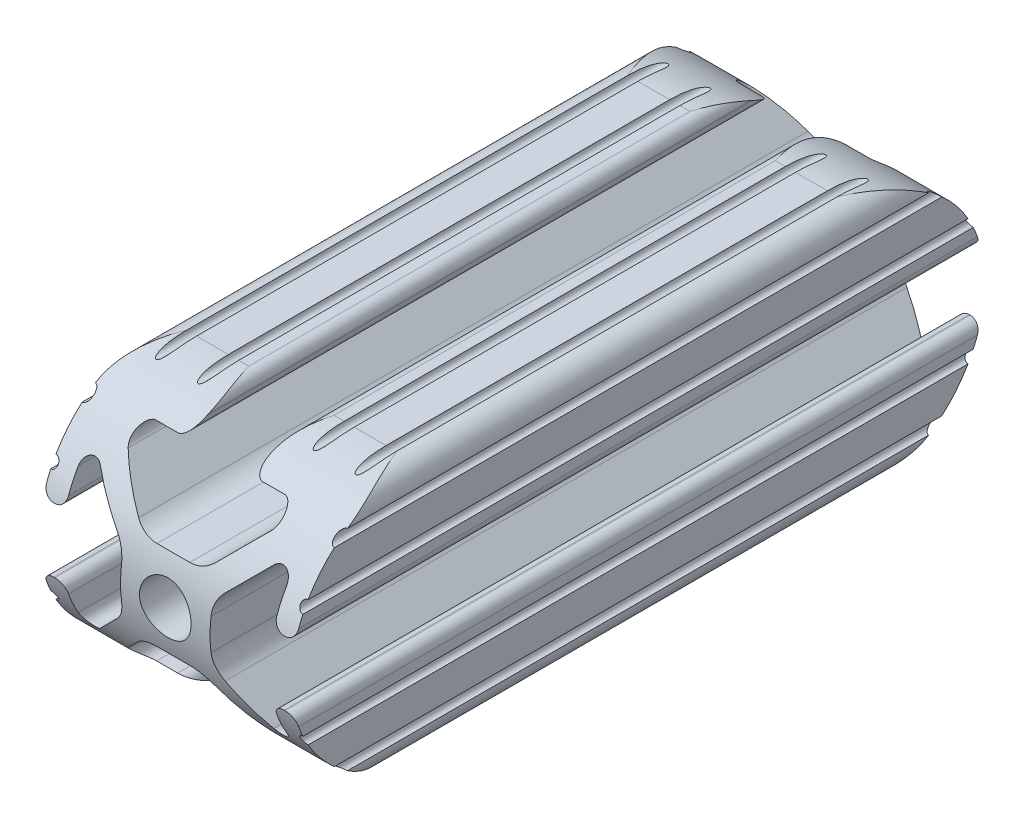
from build123d import *
from build123d.topology import SkipClean

# Parameters (mm, degrees)
SKETCH1_R           = 2.6035
BOSS_EXTRUDE1_DEPTH = 34.925
CUT_EXTRUDE1_DEPTH  = 46.01339384


with BuildPart() as part:
    # Sketch1 → Boss-Extrude1 (new, symmetric)
    with BuildSketch(Plane.XY):
        with BuildLine():
            Line((-7.179650497, -8.645192506), (-3.952270251, -5.423690499))
            ThreePointArc((-3.952270251, -5.423690499), (-2.922936451, -4.736929036), (-1.709253557, -4.4958))
            Line((-1.709253557, -4.4958), (1.709253557, -4.4958))
            ThreePointArc((1.709253557, -4.4958), (2.922936451, -4.736929036), (3.952270251, -5.423690499))
            Line((3.952270251, -5.423690499), (7.179650497, -8.645192506))
            ThreePointArc((7.179650497, -8.645192506), (7.41473083, -9.822813117), (6.416408329, -10.4902))
            Line((6.416408329, -10.4902), (4.287512407, -10.4902))
            ThreePointArc((4.287512407, -10.4902), (3.54574862, -10.79744862), (3.2385, -11.539212407))
            Line((3.2385, -11.539212407), (3.2385, -11.650987593))
            ThreePointArc((3.2385, -11.650987593), (3.54574862, -12.39275138), (4.287512407, -12.7))
            Line((4.287512407, -12.7), (5.317126718, -12.7))
            ThreePointArc((5.317126718, -12.7), (5.825126718, -12.192), (6.333126718, -12.7))
            Line((6.333126718, -12.7), (9.550443118, -12.7))
            ThreePointArc((9.550443118, -12.7), (10.058366869, -12.192000006), (10.566443095, -12.699847501))
            ThreePointArc((10.566443095, -12.699847501), (12.082537762, -12.08250727), (12.699846982, -10.566399977))
            ThreePointArc((12.699846982, -10.566399977), (12.192000006, -10.058323491), (12.7, -9.5504))
            Line((12.7, -9.5504), (12.7, -6.3330836))
            ThreePointArc((12.7, -6.3330836), (12.192, -5.8250836), (12.7, -5.3170836))
            Line((12.7, -5.3170836), (12.7, -4.287469289))
            ThreePointArc((12.7, -4.287469289), (12.39275138, -3.545705502), (11.650987593, -3.238456882))
            Line((11.650987593, -3.238456882), (11.539212407, -3.238456882))
            ThreePointArc((11.539212407, -3.238456882), (10.79744862, -3.545705502), (10.4902, -4.287469289))
            Line((10.4902, -4.287469289), (10.4902, -6.402089023))
            ThreePointArc((10.4902, -6.402089023), (9.856505071, -7.351067942), (8.737131347, -7.129408934))
            Line((8.737131347, -7.129408934), (5.441005833, -3.840816462))
            ThreePointArc((5.441005833, -3.840816462), (4.750877967, -2.809883091), (4.5085, -1.593185507))
            Line((4.5085, -1.593185507), (4.5085, 1.593185507))
            ThreePointArc((4.5085, 1.593185507), (4.750877967, 2.809883091), (5.441005833, 3.840816462))
            Line((5.441005833, 3.840816462), (8.737131347, 7.129408934))
            ThreePointArc((8.737131347, 7.129408934), (9.856505071, 7.351067942), (10.4902, 6.402089023))
            Line((10.4902, 6.402089023), (10.4902, 4.287469289))
            ThreePointArc((10.4902, 4.287469289), (10.79744862, 3.545705502), (11.539212407, 3.238456882))
            Line((11.539212407, 3.238456882), (11.650987593, 3.238456882))
            ThreePointArc((11.650987593, 3.238456882), (12.39275138, 3.545705502), (12.7, 4.287469289))
            Line((12.7, 4.287469289), (12.7, 5.3170836))
            ThreePointArc((12.7, 5.3170836), (12.192, 5.8250836), (12.7, 6.3330836))
            Line((12.7, 6.3330836), (12.7, 9.5504))
            ThreePointArc((12.7, 9.5504), (12.192000006, 10.058323491), (12.699846982, 10.566399977))
            ThreePointArc((12.699846982, 10.566399977), (12.082537762, 12.08250727), (10.566443095, 12.699847501))
            ThreePointArc((10.566443095, 12.699847501), (10.058366869, 12.192000006), (9.550443118, 12.7))
            Line((9.550443118, 12.7), (6.333126718, 12.7))
            ThreePointArc((6.333126718, 12.7), (5.825126718, 12.192), (5.317126718, 12.7))
            Line((5.317126718, 12.7), (4.287512407, 12.7))
            ThreePointArc((4.287512407, 12.7), (3.54574862, 12.39275138), (3.2385, 11.650987593))
            Line((3.2385, 11.650987593), (3.2385, 11.539212407))
            ThreePointArc((3.2385, 11.539212407), (3.54574862, 10.79744862), (4.287512407, 10.4902))
            Line((4.287512407, 10.4902), (6.476788598, 10.4902))
            ThreePointArc((6.476788598, 10.4902), (7.432222385, 9.85140422), (7.207036008, 8.724370562))
            Line((7.207036008, 8.724370562), (3.898272566, 5.423169045))
            ThreePointArc((3.898272566, 5.423169045), (2.869120213, 4.736787962), (1.655778399, 4.4958))
            Line((1.655778399, 4.4958), (-1.655778399, 4.4958))
            ThreePointArc((-1.655778399, 4.4958), (-2.869120213, 4.736787962), (-3.898272566, 5.423169045))
            Line((-3.898272566, 5.423169045), (-7.207036008, 8.724370562))
            ThreePointArc((-7.207036008, 8.724370562), (-7.432222385, 9.85140422), (-6.476788598, 10.4902))
            Line((-6.476788598, 10.4902), (-4.287512407, 10.4902))
            ThreePointArc((-4.287512407, 10.4902), (-3.54574862, 10.79744862), (-3.2385, 11.539212407))
            Line((-3.2385, 11.539212407), (-3.2385, 11.650987593))
            ThreePointArc((-3.2385, 11.650987593), (-3.54574862, 12.39275138), (-4.287512407, 12.7))
            Line((-4.287512407, 12.7), (-5.317126718, 12.7))
            ThreePointArc((-5.317126718, 12.7), (-5.825126718, 12.192), (-6.333126718, 12.7))
            Line((-6.333126718, 12.7), (-9.550443118, 12.7))
            ThreePointArc((-9.550443118, 12.7), (-10.058366869, 12.192000006), (-10.566443095, 12.699847501))
            ThreePointArc((-10.566443095, 12.699847501), (-12.082537762, 12.08250727), (-12.699846982, 10.566399977))
            ThreePointArc((-12.699846982, 10.566399977), (-12.192000006, 10.058323491), (-12.7, 9.5504))
            Line((-12.7, 9.5504), (-12.7, 6.3330836))
            ThreePointArc((-12.7, 6.3330836), (-12.192, 5.8250836), (-12.7, 5.3170836))
            Line((-12.7, 5.3170836), (-12.7, 4.287469289))
            ThreePointArc((-12.7, 4.287469289), (-12.39275138, 3.545705502), (-11.650987593, 3.238456882))
            Line((-11.650987593, 3.238456882), (-11.539212407, 3.238456882))
            ThreePointArc((-11.539212407, 3.238456882), (-10.79744862, 3.545705502), (-10.4902, 4.287469289))
            Line((-10.4902, 4.287469289), (-10.4902, 6.402089023))
            ThreePointArc((-10.4902, 6.402089023), (-9.856505071, 7.351067942), (-8.737131347, 7.129408934))
            Line((-8.737131347, 7.129408934), (-5.441005833, 3.840816462))
            ThreePointArc((-5.441005833, 3.840816462), (-4.750877967, 2.809883091), (-4.5085, 1.593185507))
            Line((-4.5085, 1.593185507), (-4.5085, -1.593185507))
            ThreePointArc((-4.5085, -1.593185507), (-4.750877967, -2.809883091), (-5.441005833, -3.840816462))
            Line((-5.441005833, -3.840816462), (-8.737131347, -7.129408934))
            ThreePointArc((-8.737131347, -7.129408934), (-9.856505071, -7.351067942), (-10.4902, -6.402089023))
            Line((-10.4902, -6.402089023), (-10.4902, -4.287469289))
            ThreePointArc((-10.4902, -4.287469289), (-10.79744862, -3.545705502), (-11.539212407, -3.238456882))
            Line((-11.539212407, -3.238456882), (-11.650987593, -3.238456882))
            ThreePointArc((-11.650987593, -3.238456882), (-12.39275138, -3.545705502), (-12.7, -4.287469289))
            Line((-12.7, -4.287469289), (-12.7, -5.3170836))
            ThreePointArc((-12.7, -5.3170836), (-12.192, -5.8250836), (-12.7, -6.3330836))
            Line((-12.7, -6.3330836), (-12.7, -9.5504))
            ThreePointArc((-12.7, -9.5504), (-12.192000006, -10.058323491), (-12.699846982, -10.566399977))
            ThreePointArc((-12.699846982, -10.566399977), (-12.082537762, -12.08250727), (-10.566443095, -12.699847501))
            ThreePointArc((-10.566443095, -12.699847501), (-10.058366869, -12.192000006), (-9.550443118, -12.7))
            Line((-9.550443118, -12.7), (-6.333126718, -12.7))
            ThreePointArc((-6.333126718, -12.7), (-5.825126718, -12.192), (-5.317126718, -12.7))
            Line((-5.317126718, -12.7), (-4.287512407, -12.7))
            ThreePointArc((-4.287512407, -12.7), (-3.54574862, -12.39275138), (-3.2385, -11.650987593))
            Line((-3.2385, -11.650987593), (-3.2385, -11.539212407))
            ThreePointArc((-3.2385, -11.539212407), (-3.54574862, -10.79744862), (-4.287512407, -10.4902))
            Line((-4.287512407, -10.4902), (-6.416408329, -10.4902))
            ThreePointArc((-6.416408329, -10.4902), (-7.41473083, -9.822813117), (-7.179650497, -8.645192506))
        make_face()
        Circle(SKETCH1_R, mode=Mode.SUBTRACT)
    extrude(amount=BOSS_EXTRUDE1_DEPTH, both=True)

    # Sketch2 → Cut-Extrude1 (cut, through all)
    with SkipClean():  # the faces are left unmerged after this step: merging them gives an invalid solid
        with BuildSketch(Plane(origin=(12.7, 0, 0), x_dir=(0, 0, -1), z_dir=(1, 0, 0))):
            with BuildLine():
                Line((22.225, -12.7), (34.925, -12.7))
                Line((34.925, -12.7), (34.925, 0))
                ThreePointArc((34.925, 0), (31.205256121, -8.980256121), (22.225, -12.7))
            make_face()
            with BuildLine():
                Line((-34.925, -12.7), (-22.225, -12.7))
                ThreePointArc((-22.225, -12.7), (-31.205256121, -8.980256121), (-34.925, 0))
                Line((-34.925, 0), (-34.925, -12.7))
            make_face()
            with BuildLine():
                ThreePointArc((22.225, 12.7), (31.205256121, 8.980256121), (34.925, 0))
                Line((34.925, 0), (34.925, 12.7))
                Line((34.925, 12.7), (22.225, 12.7))
            make_face()
            with BuildLine():
                Line((-34.925, 12.7), (-34.925, 0))
                ThreePointArc((-34.925, 0), (-31.205256104, 8.980256138), (-22.224999951, 12.7))
                Line((-22.224999951, 12.7), (-34.925, 12.7))
            make_face()
        extrude(amount=-CUT_EXTRUDE1_DEPTH, mode=Mode.SUBTRACT)


solid = part.part
